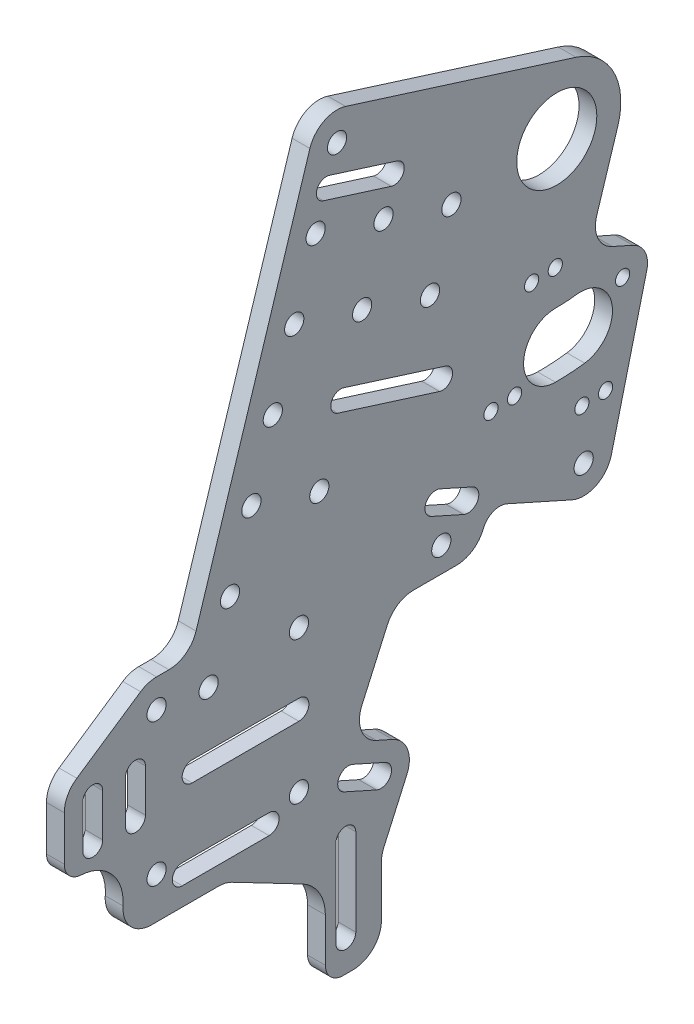
from build123d import *

# Parameters (mm, degrees)
BOSS_EXTRUDE1_DEPTH      = 3.175
BOSS_EXTRUDE1_DEPTH_BACK = 3.175
SKETCH2_R                = 14.2875
SKETCH2_R_2              = 3.429
SKETCH2_R_3              = 2.54


with BuildPart() as part:
    # Sketch2 → Boss-Extrude1 (new, two sides: drawn at the far end of the back side and taken through both)
    with BuildSketch(Plane(origin=(0, 0, 0), x_dir=(0, 0, -1), z_dir=(1, 0, 0)).offset(-BOSS_EXTRUDE1_DEPTH_BACK)):
        with BuildLine():
            Line((38.021448917, 246.234864084), (120.241230069, 220.311066665))
            ThreePointArc((120.241230069, 220.311066665), (133.644163138, 209.06467047), (135.169064986, 191.634962595))
            Line((135.169064986, 191.634962595), (127.622152065, 167.6992128))
            ThreePointArc((127.622152065, 167.6992128), (128.044603019, 160.47960856), (133.162508812, 155.36999111))
            Line((133.162508812, 155.36999111), (140.48887895, 152.092017357))
            ThreePointArc((140.48887895, 152.092017357), (144.852236282, 147.866521475), (145.483799346, 141.825426314))
            Line((145.483799346, 141.825426314), (132.821367632, 91.06703794))
            ThreePointArc((132.821367632, 91.06703794), (127.408392323, 84.390132513), (118.814072234, 84.252183312))
            Line((118.814072234, 84.252183312), (95.644233558, 94.61886171))
            ThreePointArc((95.644233558, 94.61886171), (90.786060122, 94.754966448), (87.254572158, 91.415959651))
            Line((87.254572158, 91.415959651), (86.910445683, 90.646826606))
            ThreePointArc((86.910445683, 90.646826606), (83.162135594, 86.27028604), (77.636394916, 84.636234079))
            Line((77.636394916, 84.636234079), (62.21871433, 84.636234079))
            ThreePointArc((62.21871433, 84.636234079), (56.692973652, 83.002182118), (52.944663563, 78.625641552))
            Line((52.944663563, 78.625641552), (43.839685496, 58.275741142))
            ThreePointArc((43.839685496, 58.275741142), (43.621917914, 50.502663645), (48.96432879, 44.852282903))
            Line((48.96432879, 44.852282903), (54.760610519, 42.258903232))
            ThreePointArc((54.760610519, 42.258903232), (60.103021394, 36.60852249), (59.885253813, 28.835444993))
            Line((59.885253813, 28.835444993), (51.685949233, 10.509752126))
            ThreePointArc((51.685949233, 10.509752126), (51.023955621, 8.481811623), (50.8, 6.360344653))
            Line((50.8, 6.360344653), (50.8, -11.7475))
            ThreePointArc((50.8, -11.7475), (47.824204897, -18.931704897), (40.64, -21.9075))
            Line((40.64, -21.9075), (37.1475, -21.9075))
            ThreePointArc((37.1475, -21.9075), (32.657371939, -20.047628061), (30.7975, -15.5575))
            Line((30.7975, -15.5575), (30.7975, 0))
            ThreePointArc((30.7975, 0), (28.552596998, 8.032774411), (22.468409419, 13.737834946))
            Line((22.468409419, 13.737834946), (-2.554479623, 26.788416358))
            ThreePointArc((-2.554479623, 26.788416358), (-4.834094275, 27.647905305), (-7.252780881, 27.94))
            Line((-7.252780881, 27.94), (-31.256978796, 27.94))
            ThreePointArc((-31.256978796, 27.94), (-38.707276299, 31.19213006), (-41.38801938, 38.866561592))
            ThreePointArc((-41.38801938, 38.866561592), (-45.28789684, 50.537792221), (-56.355984579, 55.915905494))
            ThreePointArc((-56.355984579, 55.915905494), (-60.621662669, 57.889989399), (-62.361270294, 62.25654206))
            Line((-62.361270294, 62.25654206), (-62.361270294, 78.164314079))
            ThreePointArc((-62.361270294, 78.164314079), (-61.17251471, 82.933210558), (-57.884425091, 86.586151856))
            Line((-57.884425091, 86.586151856), (-35.119675091, 101.948071856))
            ThreePointArc((-35.119675091, 101.948071856), (-32.408029017, 103.24198088), (-29.436520294, 103.686234079))
            Line((-29.436520294, 103.686234079), (-25.026637608, 103.686234079))
            ThreePointArc((-25.026637608, 103.686234079), (-19.01893158, 105.6527569), (-15.336873388, 110.791063156))
            Line((-15.336873388, 110.791063156), (25.276513775, 239.600270788))
            ThreePointArc((25.276513775, 239.600270788), (30.274912084, 245.55712993), (38.021448917, 246.234864084))
        make_face()
        with Locations((113.367095492, 198.509097171)):
            Circle(SKETCH2_R, mode=Mode.SUBTRACT)
        with Locations((-29.436520294, 42.726234079)):
            Circle(SKETCH2_R_2, mode=Mode.SUBTRACT)
        with Locations((21.363479706, 93.526234079)):
            Circle(SKETCH2_R_2, mode=Mode.SUBTRACT)
        with Locations((122.963479706, 93.526234079)):
            Circle(SKETCH2_R_2, mode=Mode.SUBTRACT)
        with Locations((104.398969727, 158.50014909)):
            Circle(SKETCH2_R_3, mode=Mode.SUBTRACT)
        with Locations((136.858147411, 143.977222936)):
            Circle(SKETCH2_R_3, mode=Mode.SUBTRACT)
        with Locations((122.335221257, 111.518045252)):
            Circle(SKETCH2_R_3, mode=Mode.SUBTRACT)
        with Locations((89.876043573, 126.040971407)):
            Circle(SKETCH2_R_3, mode=Mode.SUBTRACT)
        with Locations((112.840572264, 159.063757816)):
            Circle(SKETCH2_R_3, mode=Mode.SUBTRACT)
        with Locations((130.776823793, 112.081653978)):
            Circle(SKETCH2_R_3, mode=Mode.SUBTRACT)
        with Locations((98.317646109, 126.604580132)):
            Circle(SKETCH2_R_3, mode=Mode.SUBTRACT)
        with Locations((-29.436520294, 93.526234079)):
            Circle(SKETCH2_R_2, mode=Mode.SUBTRACT)
        with Locations((21.363479706, 42.726234079)):
            Circle(SKETCH2_R_2, mode=Mode.SUBTRACT)
        with Locations((72.163479706, 93.526234079)):
            Circle(SKETCH2_R_2, mode=Mode.SUBTRACT)
        with Locations((34.966277994, 236.545099865)):
            Circle(SKETCH2_R_2, mode=Mode.SUBTRACT)
        with Locations((27.328350687, 212.320689316)):
            Circle(SKETCH2_R_2, mode=Mode.SUBTRACT)
        with Locations((19.690423379, 188.096278767)):
            Circle(SKETCH2_R_2, mode=Mode.SUBTRACT)
        with Locations((12.052496072, 163.871868218)):
            Circle(SKETCH2_R_2, mode=Mode.SUBTRACT)
        with Locations((4.414568765, 139.647457669)):
            Circle(SKETCH2_R_2, mode=Mode.SUBTRACT)
        with Locations((-3.223358543, 115.42304712)):
            Circle(SKETCH2_R_2, mode=Mode.SUBTRACT)
        with Locations((-10.86128585, 91.198636571)):
            Circle(SKETCH2_R_2, mode=Mode.SUBTRACT)
        with Locations((51.552761236, 204.682762008)):
            Circle(SKETCH2_R_2, mode=Mode.SUBTRACT)
        with Locations((43.914833928, 180.458351459)):
            Circle(SKETCH2_R_2, mode=Mode.SUBTRACT)
        with Locations((75.777171785, 197.044834701)):
            Circle(SKETCH2_R_2, mode=Mode.SUBTRACT)
        with Locations((68.139244477, 172.820424152)):
            Circle(SKETCH2_R_2, mode=Mode.SUBTRACT)
        with Locations((28.638979314, 132.009530361)):
            Circle(SKETCH2_R_2, mode=Mode.SUBTRACT)
        with BuildLine():
            Line((30.078004517, 221.041477113), (54.302415066, 213.403549806))
            ThreePointArc((54.302415066, 213.403549806), (58.763142366, 215.72565746), (56.441034713, 220.18638476))
            Line((56.441034713, 220.18638476), (32.216624164, 227.824312067))
            ThreePointArc((32.216624164, 227.824312067), (27.755896864, 225.502204413), (30.078004517, 221.041477113))
        make_face(mode=Mode.SUBTRACT)
        with BuildLine():
            Line((41.656, 20.2565), (41.656, -10.7315))
            ThreePointArc((41.656, -10.7315), (38.1, -14.2875), (34.544, -10.7315))
            Line((34.544, -10.7315), (34.544, 20.2565))
            ThreePointArc((34.544, 20.2565), (38.1, 23.8125), (41.656, 20.2565))
        make_face(mode=Mode.SUBTRACT)
        with BuildLine():
            Line((-20.2565, 41.656), (10.7315, 41.656))
            ThreePointArc((10.7315, 41.656), (14.2875, 38.1), (10.7315, 34.544))
            Line((10.7315, 34.544), (-20.2565, 34.544))
            ThreePointArc((-20.2565, 34.544), (-23.8125, 38.1), (-20.2565, 41.656))
        make_face(mode=Mode.SUBTRACT)
        with BuildLine():
            Line((-48.645270294, 78.164314079), (-48.645270294, 62.924314079))
            ThreePointArc((-48.645270294, 62.924314079), (-52.201270294, 59.368314079), (-55.757270294, 62.924314079))
            Line((-55.757270294, 62.924314079), (-55.757270294, 78.164314079))
            ThreePointArc((-55.757270294, 78.164314079), (-52.201270294, 81.720314079), (-48.645270294, 78.164314079))
        make_face(mode=Mode.SUBTRACT)
        with BuildLine():
            Line((-33.405270294, 78.164314079), (-33.405270294, 62.924314079))
            ThreePointArc((-33.405270294, 62.924314079), (-36.961270294, 59.368314079), (-40.517270294, 62.924314079))
            Line((-40.517270294, 62.924314079), (-40.517270294, 78.164314079))
            ThreePointArc((-40.517270294, 78.164314079), (-36.961270294, 81.720314079), (-33.405270294, 78.164314079))
        make_face(mode=Mode.SUBTRACT)
        with BuildLine():
            Line((37.346216444, 159.625358387), (73.682832268, 148.168467426))
            ThreePointArc((73.682832268, 148.168467426), (76.004939921, 143.707740126), (71.544212621, 141.385632472))
            Line((71.544212621, 141.385632472), (35.207596798, 152.842523433))
            ThreePointArc((35.207596798, 152.842523433), (32.885489144, 157.303250733), (37.346216444, 159.625358387))
        make_face(mode=Mode.SUBTRACT)
        with BuildLine():
            Line((-16.736520294, 71.682234079), (21.363479706, 71.682234079))
            ThreePointArc((21.363479706, 71.682234079), (24.919479706, 68.126234079), (21.363479706, 64.570234079))
            Line((21.363479706, 64.570234079), (-16.736520294, 64.570234079))
            ThreePointArc((-16.736520294, 64.570234079), (-20.292520294, 68.126234079), (-16.736520294, 71.682234079))
        make_face(mode=Mode.SUBTRACT)
        with BuildLine():
            Line((71.695223435, 111.204761595), (83.287786894, 106.018002254))
            ThreePointArc((83.287786894, 106.018002254), (85.209528129, 100.984205414), (80.175731289, 99.062464179))
            Line((80.175731289, 99.062464179), (68.583167831, 104.24922352))
            ThreePointArc((68.583167831, 104.24922352), (66.661426596, 109.28302036), (71.695223435, 111.204761595))
        make_face(mode=Mode.SUBTRACT)
        with BuildLine():
            Line((40.57466739, 41.649380844), (52.167230848, 36.462621503))
            ThreePointArc((52.167230848, 36.462621503), (54.088972084, 31.428824663), (49.055175244, 29.507083428))
            Line((49.055175244, 29.507083428), (37.462611785, 34.693842769))
            ThreePointArc((37.462611785, 34.693842769), (35.54087055, 39.727639609), (40.57466739, 41.649380844))
        make_face(mode=Mode.SUBTRACT)
        with BuildLine():
            ThreePointArc((112.879749334, 123.580682042), (118.115569936, 123.729709032), (123.328186485, 124.244155468))
            ThreePointArc((123.328186485, 124.244155468), (133.137248458, 137.092194354), (120.289209572, 146.901256326))
            ThreePointArc((120.289209572, 146.901256326), (116.666882818, 146.543759651), (113.028431213, 146.440198522))
            ThreePointArc((113.028431213, 146.440198522), (101.524332034, 135.084781222), (112.879749334, 123.580682042))
        make_face(mode=Mode.SUBTRACT)
    extrude(amount=BOSS_EXTRUDE1_DEPTH + BOSS_EXTRUDE1_DEPTH_BACK)


solid = part.part
